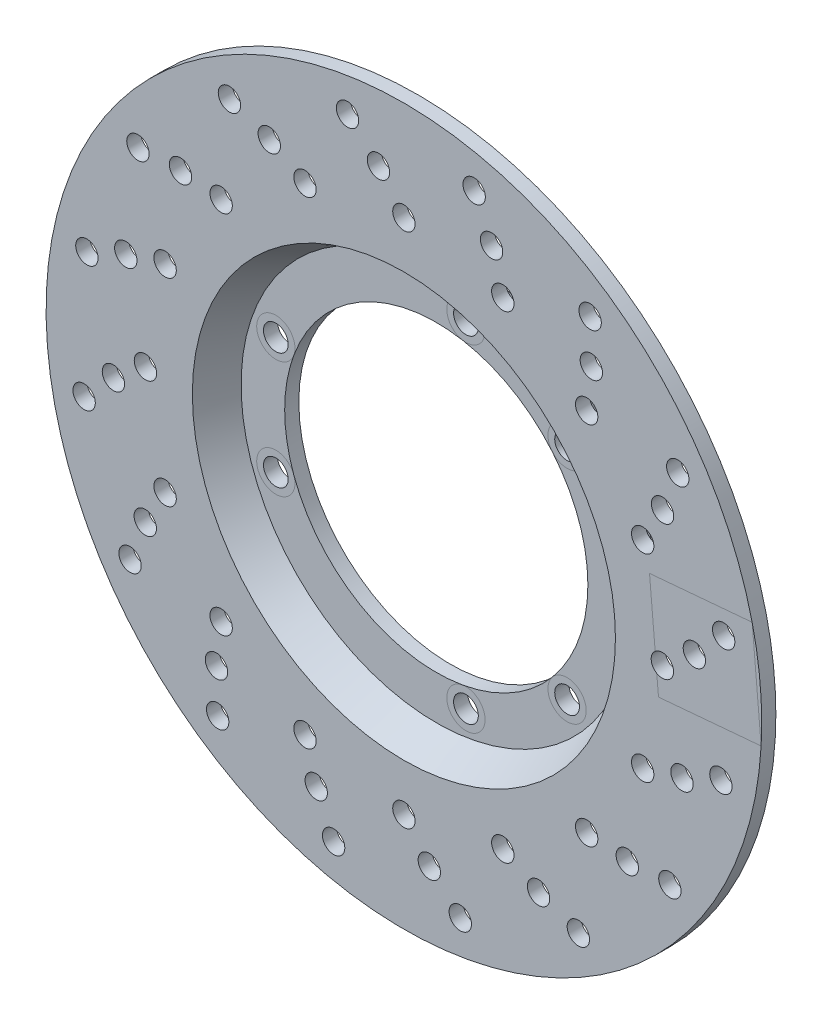
from build123d import *

# Parameters (mm, degrees)
SKETCH3_R                  = 51.5
CUT_EXTRUDE1_DEPTH         = 173.622261021
SKETCH4_R                  = 4.2
CUT_EXTRUDE2_DEPTH         = 173.622261021
F_7_6_7_6_DIAMETER_HOLE1_D = 7.6
CIRPATTERN1_COUNT          = 16


with BuildPart() as part:
    # Sketch2 → Revolve1 (revolve)
    with BuildSketch(Plane(origin=(0, 0, 0), x_dir=(1, 0, 0), z_dir=(0, 1, 0))):
        Polygon((0, 0), (0, 4.8), (-71, 4.8), (-76.55, -6.2), (-121.55, -6.2), (-121.55, -11), (-71.859347289, -11), (-66.309347289, 0), align=None)
    revolve(axis=Axis((0, 0, 0), (0, 0, -1)))

    # Sketch3 → Cut-Extrude1 (cut, through all)
    with BuildSketch(Plane(origin=(0, 0, -4.8), x_dir=(-1, 0, 0), z_dir=(0, 0, -1))):
        Circle(SKETCH3_R)
    extrude(amount=-CUT_EXTRUDE1_DEPTH, mode=Mode.SUBTRACT)

    # Sketch4 → Cut-Extrude2 (cut, through all)
    with BuildSketch(Plane(origin=(0, 0, -4.8), x_dir=(-1, 0, 0), z_dir=(0, 0, -1))):
        with Locations((-10.071594305, -57.118849675)):
            Circle(SKETCH4_R)
        with Locations((-44.430577701, -37.281681362)):
            Circle(SKETCH4_R)
        with Locations((54.502172006, -19.837168313)):
            Circle(SKETCH4_R)
        with Locations((54.502172006, 19.837168313)):
            Circle(SKETCH4_R)
        with Locations((-10.071594305, 57.118849675)):
            Circle(SKETCH4_R)
        with Locations((-44.430577701, 37.281681362)):
            Circle(SKETCH4_R)
    extrude(amount=-CUT_EXTRUDE2_DEPTH, mode=Mode.SUBTRACT)

    # Ø7.6 (7.6) Diameter Hole1 (through all)
    with Locations(Plane(origin=(0, 0, 6.2), x_dir=(-1, 0, 0), z_dir=(0, 0, -1))):
        with Locations((108.624295157, -19.153393997), (87.8, 0), (98.673084846, -8.632776319)):
            f_7_6_7_6_diameter_hole1 = Hole(F_7_6_7_6_DIAMETER_HOLE1_D / 2)

    # CirPattern1: Ø7.6 (7.6) Diameter Hole1 ×16 about axis
    cirpattern1_axis = Axis((0, 0, -4.8), (0, 0, -1))
    for i in range(1, CIRPATTERN1_COUNT):
        add(f_7_6_7_6_diameter_hole1.rotate(cirpattern1_axis, i * 360 / CIRPATTERN1_COUNT), mode=Mode.SUBTRACT)


solid = part.part
